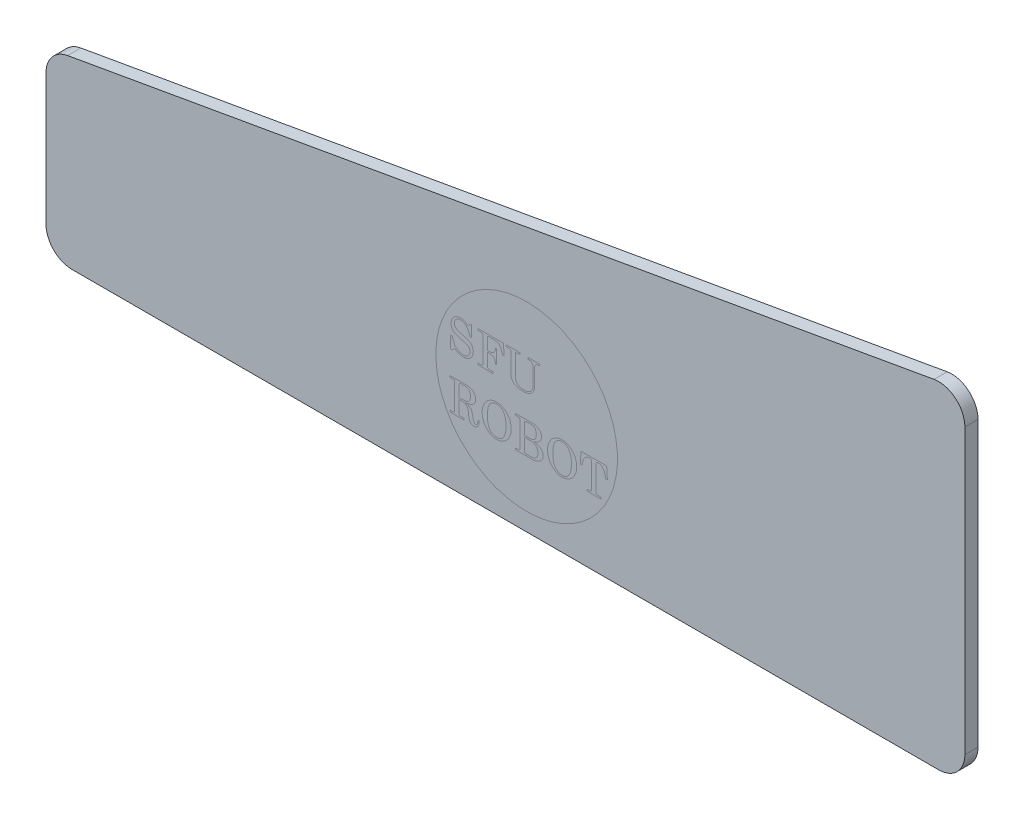
from build123d import *

# Parameters (mm, degrees)
BOSS_EXTRUDE1_DEPTH = 5
FILLET2_R           = 10


with BuildPart() as part:
    # Sketch1 → Boss-Extrude1 (new body)
    with BuildSketch(Plane.XY):
        Polygon((0, 0), (-350, 0), (-350, 68.285556752), (0, 130), align=None)
    extrude(amount=BOSS_EXTRUDE1_DEPTH)

    # Fillet2
    fillet2_edges = [part.edges().sort_by_distance(p)[0] for p in [
        (0, 0, 2.5),
        (-350, 0, 2.5),
        (-350, 68.285556752, 2.5),
        (0, 130, 2.5),
    ]]
    fillet(fillet2_edges, radius=FILLET2_R)


solid = part.part
